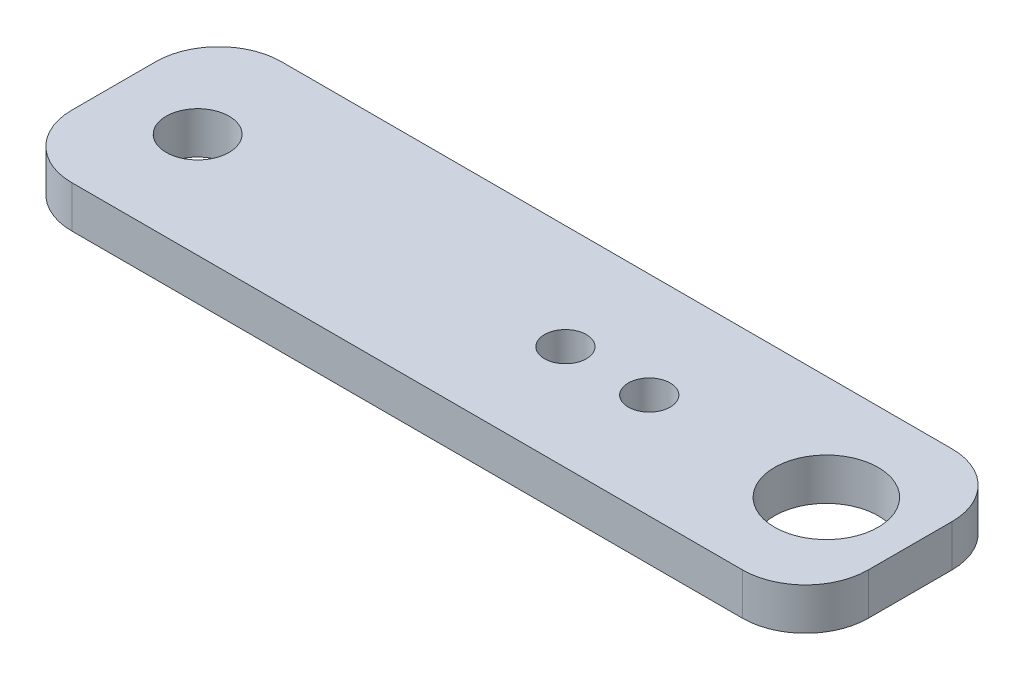
from build123d import *

# Parameters (mm, degrees)
SKETCH1_W                = 38
SKETCH1_H                = 10
BOSS_EXTRUDE1_DEPTH      = 2
SKETCH2_R                = 2.472864358
SKETCH2_R_2              = 1
CUT_EXTRUDE1_DEPTH       = 3
FILLET1_R                = 3
F_3_0_3_DIAMETER_HOLE1_D = 3


with BuildPart() as part:
    # Sketch1 → Boss-Extrude1 (new body)
    with BuildSketch(Plane(origin=(0, 0, 0), x_dir=(1, 0, 0), z_dir=(0, 1, 0))):
        Rectangle(SKETCH1_W, SKETCH1_H)
    extrude(amount=BOSS_EXTRUDE1_DEPTH)

    # Sketch2 → Cut-Extrude1 (cut)
    with BuildSketch(Plane(origin=(0, 2, 0), x_dir=(1, 0, 0), z_dir=(0, 1, 0))):
        with Locations((15, 0)):
            Circle(SKETCH2_R)
        with Locations((6.55, 0)):
            Circle(SKETCH2_R_2)
        with Locations((2.55, 0)):
            Circle(SKETCH2_R_2)
    extrude(amount=-CUT_EXTRUDE1_DEPTH, mode=Mode.SUBTRACT)

    # Fillet1
    fillet1_edges = [part.edges().sort_by_distance(p)[0] for p in [
        (19, 1, 5),
        (19, 1, -5),
        (-19, 1, -5),
        (-19, 1, 5),
    ]]
    fillet(fillet1_edges, radius=FILLET1_R)

    # Ø3.0 (3) Diameter Hole1 (through all)
    with Locations(Plane(origin=(0, 2, 0), x_dir=(1, 0, 0), z_dir=(0, 1, 0))):
        with Locations((-15, 0)):
            Hole(F_3_0_3_DIAMETER_HOLE1_D / 2)


solid = part.part
